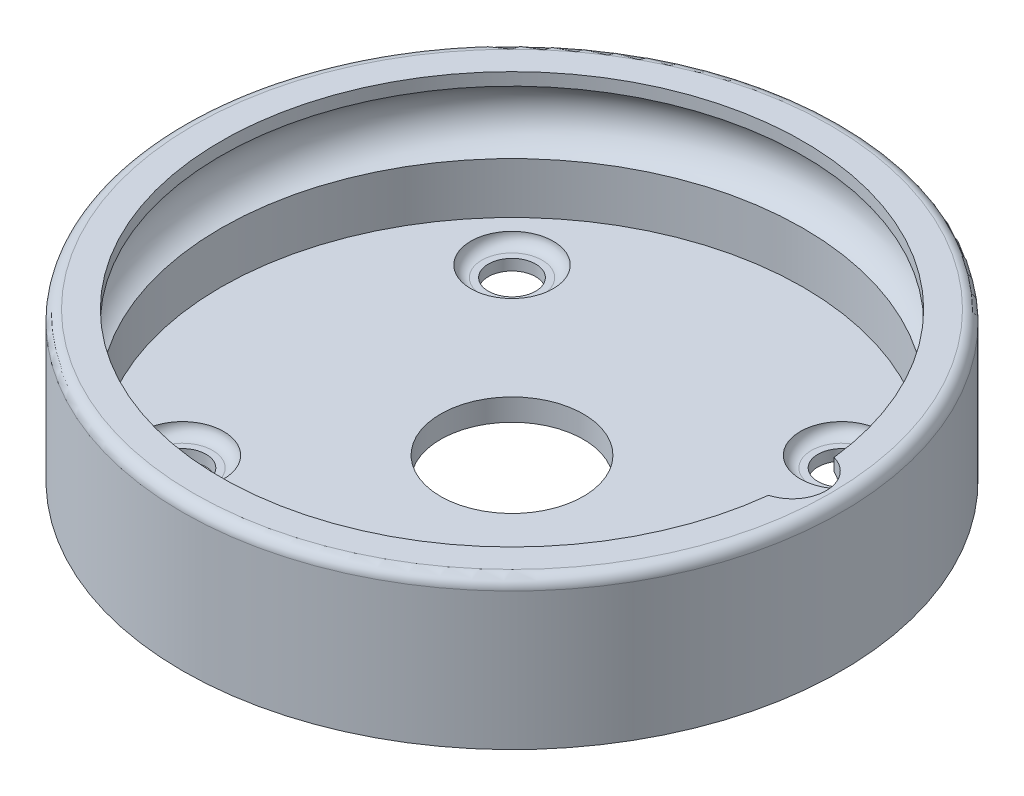
from build123d import *

# Parameters (mm, degrees)
SKETCH_3_R                       = 3.1
CUT_EXTRUDE_2_DEPTH              = 4
CUT_EXTRUDE_3_DEPTH              = 44.957365734
SKETCH_5_R                       = 3.75
CUT_EXTRUDE_4_DEPTH              = 1
FILLET_1_R                       = 1
PATTERN_CIRCULAR_1_COUNT         = 4
FILLET_1_OF_PATTERN_CIRCULAR_1_R = 1
SKETCH_6_R                       = 1
CUT_EXTRUDE_5_DEPTH              = 44.957365734


with BuildPart() as part:
    # 草图1 → 旋转2 (revolve)
    with BuildSketch(Plane.XY, mode=Mode.PRIVATE) as revolve_2_sk:
        with BuildLine():
            Line((6.5, 2), (6.5, 0))
            Line((6.5, 0), (30, 0))
            Line((30, 0), (30, 12.5))
            ThreePointArc((30, 12.5), (29.707106781, 13.207106781), (29, 13.5))
            Line((29, 13.5), (26.5, 13.5))
            Line((26.5, 13.5), (26.5, 12.354929947))
            ThreePointArc((26.5, 12.354929947), (28.525, 9.5), (26.5, 6.645070053))
            Line((26.5, 6.645070053), (26.5, 2))
            Line((26.5, 2), (6.5, 2))
        make_face()
    revolve(revolve_2_sk.sketch.rotate(Axis((0, 2, 0), (0, -1, 0)), 90), axis=Axis((0, 2, 0), (0, -1, 0)))

    # 草图3 → 切除-拉伸2 (cut)
    with BuildSketch(Plane(origin=(0, 13.5, 0), x_dir=(1, 0, 0), z_dir=(0, 1, 0))):
        with Locations((25.5, 0)):
            Circle(SKETCH_3_R)
    extrude(amount=-CUT_EXTRUDE_2_DEPTH, mode=Mode.SUBTRACT)

    # 草图4 → 切除-拉伸3 (cut, through all)
    with BuildSketch(Plane(origin=(0, 2, 0), x_dir=(1, 0, 0), z_dir=(0, 1, 0))):
        with BuildLine():
            Line((-15, 12.85), (-15, 15))
            Line((-15, 15), (-12.85, 15))
            ThreePointArc((-12.85, 15), (-16.52027958, 16.52027958), (-15, 12.85))
        make_face()
        with BuildLine():
            Line((-12.85, 15), (-15, 15))
            Line((-15, 15), (-15, 12.85))
            ThreePointArc((-15, 12.85), (-13.47972042, 13.47972042), (-12.85, 15))
        make_face()
    cut_extrude_3 = extrude(amount=-CUT_EXTRUDE_3_DEPTH, mode=Mode.SUBTRACT)

    # 草图5 → 切除-拉伸4 (cut)
    with BuildSketch(Plane(origin=(0, 2, 0), x_dir=(1, 0, 0), z_dir=(0, 1, 0))):
        with Locations(Location((-15, 15, 0), (0, 0, 270))):
            Circle(SKETCH_5_R)
    cut_extrude_4 = extrude(amount=-CUT_EXTRUDE_4_DEPTH, mode=Mode.SUBTRACT)

    # 圆角1
    fillet_1_edges = [part.edges().sort_by_distance(p)[0] for p in [
        (-15, 1, -18.75),
    ]]
    fillet(fillet_1_edges, radius=FILLET_1_R - 0.0001)  # a hair under: the kernel refuses the full size

    # 阵列(圆周)1: 切除-拉伸3, 切除-拉伸4 ×4 about axis
    pattern_circular_1_axis = Axis((0, 0, 0), (0, 1, 0))
    add([cut_extrude_3.rotate(pattern_circular_1_axis, i * 360 / PATTERN_CIRCULAR_1_COUNT) for i in range(1, PATTERN_CIRCULAR_1_COUNT)], mode=Mode.SUBTRACT)
    add([cut_extrude_4.rotate(pattern_circular_1_axis, i * 360 / PATTERN_CIRCULAR_1_COUNT) for i in range(1, PATTERN_CIRCULAR_1_COUNT)], mode=Mode.SUBTRACT)

    # 圆角1 of 阵列(圆周)1
    fillet_1_of_pattern_circular_1_edges = [part.edges().sort_by_distance(p)[0] for p in [
        (-18.75, 1, 15),
        (15, 1, 18.75),
        (18.75, 1, -15),
    ]]
    fillet(fillet_1_of_pattern_circular_1_edges, radius=FILLET_1_OF_PATTERN_CIRCULAR_1_R - 0.0001)  # a hair under: the kernel refuses the full size

    # 草图6 → 切除-拉伸5 (cut, through all)
    with BuildSketch(Plane(origin=(0, 2, 0), x_dir=(1, 0, 0), z_dir=(0, 1, 0))):
        with Locations(Location((25.5, 0, 0), (0, 0, 270))):
            Circle(SKETCH_6_R)
    extrude(amount=-CUT_EXTRUDE_5_DEPTH, mode=Mode.SUBTRACT)


solid = part.part
